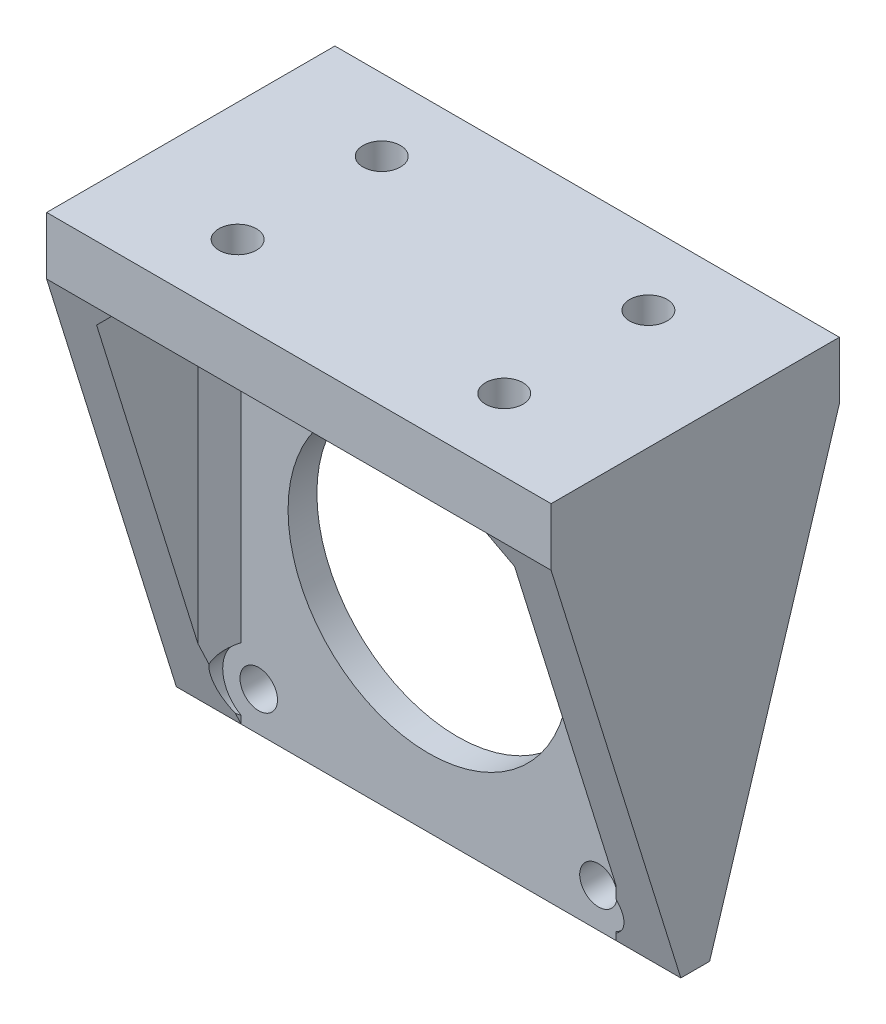
from build123d import *

# Parameters (mm, degrees)
SKETCH_1_W          = 58
SKETCH_1_H          = 58
EXTRUDE_1_DEPTH     = 4
SKETCH_6_R          = 19.5
SKETCH_6_R_2        = 2.6
CUT_EXTRUDE_1_DEPTH = 42.206795556
SKETCH_3_W          = 70
SKETCH_3_H          = 40
EXTRUDE_2_DEPTH     = 8
EXTRUDE_3_DEPTH     = 6
SKETCH_8_R          = 2.6
CUT_EXTRUDE_2_DEPTH = 72.224995612
SKETCH_9_R          = 5
CUT_EXTRUDE_3_DEPTH = 3
CHAMFER_2_SIZE      = 3
CHAMFER_1_SIZE      = 3
SKETCH_11_R         = 5
CUT_EXTRUDE_4_DEPTH = 56.479726027


with BuildPart() as part:
    # Эскиз1 → Бобышка-Вытянуть1 (new body)
    with BuildSketch(Plane.XY):
        Rectangle(SKETCH_1_W, SKETCH_1_H)
    extrude(amount=EXTRUDE_1_DEPTH)

    # Эскиз6 → Вырез-Вытянуть1 (cut, through all)
    with BuildSketch(Plane.XY.offset(4)):
        Circle(SKETCH_6_R)
        with Locations((-23.57, 23.57)):
            Circle(SKETCH_6_R_2)
        with Locations((23.57, 23.57)):
            Circle(SKETCH_6_R_2)
        with Locations((-23.57, -23.57)):
            Circle(SKETCH_6_R_2)
        with Locations((23.57, -23.57)):
            Circle(SKETCH_6_R_2)
    extrude(amount=-CUT_EXTRUDE_1_DEPTH, mode=Mode.SUBTRACT)

    # Эскиз3 → Бобышка-Вытянуть2 (add)
    with BuildSketch(Plane(origin=(0, 29, 0), x_dir=(1, 0, 0), z_dir=(0, 1, 0))):
        with Locations((0, -2)):
            Rectangle(SKETCH_3_W, SKETCH_3_H)
    extrude(amount=EXTRUDE_2_DEPTH)

    # Эскиз5 → Бобышка-Вытянуть3 (add)
    with BuildSketch(Plane(origin=(29, 0, 0), x_dir=(0, 0, -1), z_dir=(1, 0, 0))):
        Polygon((-4, -29), (0, -29), (18, 29), (-22, 29), align=None)
    extrude_3 = extrude(amount=EXTRUDE_3_DEPTH)

    # Зеркальное отражение3: Бобышка-Вытянуть3 across plane
    add(extrude_3.mirror(Plane(origin=(0, 0, 0), x_dir=(0, 0, 1), z_dir=(1, 0, 0))))

    # Эскиз8 → Вырез-Вытянуть2 (cut, through all)
    with BuildSketch(Plane(origin=(0, 29, 0), x_dir=(1, 0, 0), z_dir=(0, 1, 0))):
        with Locations((18.5, 8)):
            Circle(SKETCH_8_R)
        with Locations(Location((-18.5, 8, 0), (0, 0, 180))):
            Circle(SKETCH_8_R)
        with Locations(Location((18.5, -12, 0), (0, 0, 180))):
            Circle(SKETCH_8_R)
        with Locations((-18.5, -12)):
            Circle(SKETCH_8_R)
    extrude(amount=CUT_EXTRUDE_2_DEPTH, mode=Mode.SUBTRACT)

    # Эскиз9 → Вырез-Вытянуть3 (cut)
    with BuildSketch(Plane.XZ.offset(-29)):
        with Locations((-18.5, -8)):
            Circle(SKETCH_9_R)
        with Locations((18.5, -8)):
            Circle(SKETCH_9_R)
    extrude(amount=-CUT_EXTRUDE_3_DEPTH, mode=Mode.SUBTRACT)

    # Фаска2
    # the kernel refuses this chamfer: 3 mm, written as the material it adds along each edge
    with BuildSketch(Plane(origin=(29, -29, 4), x_dir=(0.027495876610586775, 0, 0.9996219169112968), z_dir=(0, 1, 0))) as chamfer_2_piece_1_section:
        Polygon((CHAMFER_2_SIZE * 0.999621916911, -CHAMFER_2_SIZE * 0.0274958766106), (-CHAMFER_2_SIZE * 0.0274958766106, -CHAMFER_2_SIZE * 0.999621916911), (0, 0), align=None)
    chamfer_2_piece_1 = extrude(amount=65.715048964, mode=Mode.PRIVATE)
    chamfer_2_piece_1 = split(chamfer_2_piece_1, bisect_by=Plane(origin=(27.993637715, -0.868614474, 12.730429991), z_dir=(0, 0.2963992148724529, -0.9550641368112371)), keep=Keep.TOP, mode=Mode.PRIVATE)
    chamfer_2_piece_1 = chamfer_2_piece_1 - Plane(origin=(23.57, -23.57, 4.956337432), x_dir=(1, 0, 0), z_dir=(0, 0, 1)) * Cylinder(2.6, 144, mode=Mode.PRIVATE)
    chamfer_2_piece_1 = chamfer_2_piece_1 - Plane(origin=(23.57, 23.57, 4.956337432), x_dir=(1, 0, 0), z_dir=(0, 0, 1)) * Cylinder(2.6, 144, mode=Mode.PRIVATE)
    add(chamfer_2_piece_1)
    with BuildSketch(Plane(origin=(-29, 36.715048964, 4), x_dir=(0.9996219169112968, 0, -0.027495876610586334), z_dir=(0, -1, 0))) as chamfer_2_piece_2_section:
        Polygon((CHAMFER_2_SIZE * 0.999621916911, CHAMFER_2_SIZE * 0.0274958766106), (-CHAMFER_2_SIZE * 0.0274958766106, CHAMFER_2_SIZE * 0.999621916911), (0, 0), align=None)
    chamfer_2_piece_2 = extrude(amount=65.715048964, mode=Mode.PRIVATE)
    chamfer_2_piece_2 = split(chamfer_2_piece_2, bisect_by=Plane(origin=(-28.01061912, 27.703260845, 21.597563711), z_dir=(0, 0.2963992148724529, -0.9550641368112371)), keep=Keep.TOP, mode=Mode.PRIVATE)
    chamfer_2_piece_2 = chamfer_2_piece_2 - Plane(origin=(-23.57, -23.57, 4.98938088), x_dir=(1, 0, 0), z_dir=(0, 0, 1)) * Cylinder(2.6, 144, mode=Mode.PRIVATE)
    chamfer_2_piece_2 = chamfer_2_piece_2 - Plane(origin=(-23.57, 23.57, 4.98938088), x_dir=(1, 0, 0), z_dir=(0, 0, 1)) * Cylinder(2.6, 144, mode=Mode.PRIVATE)
    add(chamfer_2_piece_2)

    # Фаска1
    chamfer_1_edges = [part.edges().sort_by_distance(p)[0] for p in [
        (-29, 29, 14.5),
        (29, 29, 14.5),
        (29, 29, -9),
        (-29, 29, -9),
    ]]
    chamfer(chamfer_1_edges, length=CHAMFER_1_SIZE)

    # Эскиз11 → Вырез-Вытянуть4 (cut, through all)
    with BuildSketch(Plane.XY.offset(4)):
        with Locations((-23.57, 23.57)):
            Circle(SKETCH_11_R)
        with Locations((23.57, 23.57)):
            Circle(SKETCH_11_R)
        with Locations((23.57, -23.57)):
            Circle(SKETCH_11_R)
        with Locations((-23.57, -23.57)):
            Circle(SKETCH_11_R)
    extrude(amount=CUT_EXTRUDE_4_DEPTH, mode=Mode.SUBTRACT)


solid = part.part
